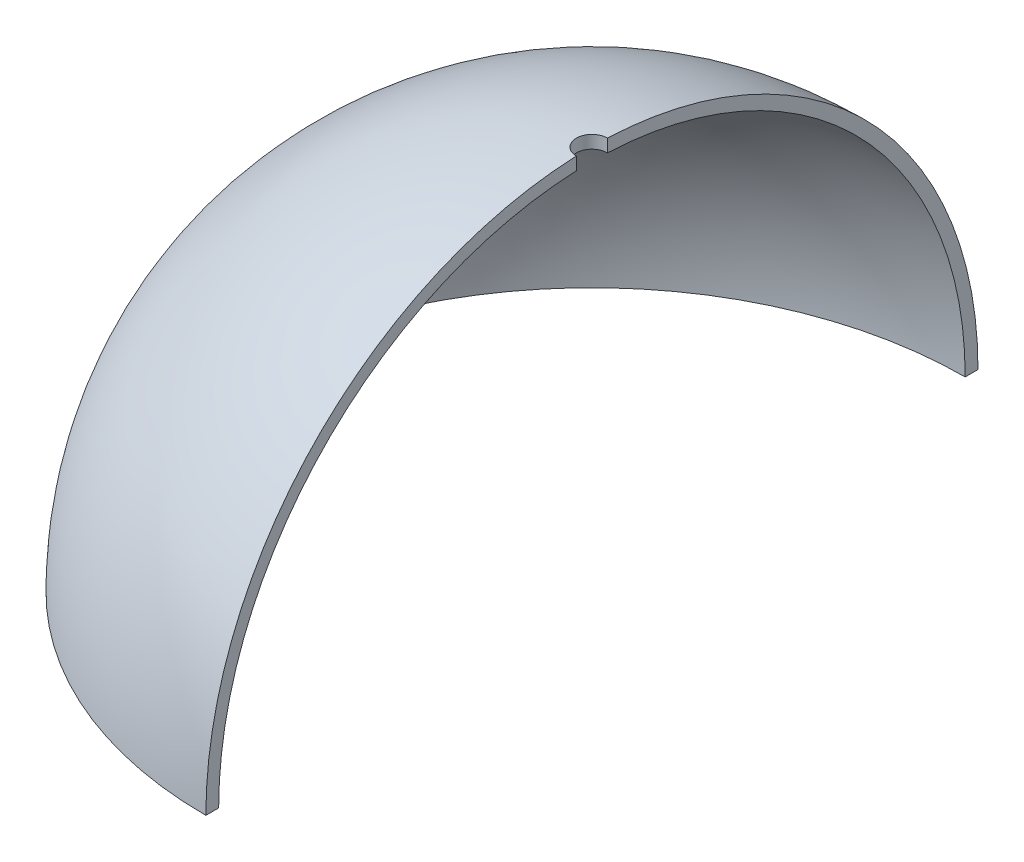
from build123d import *

# Parameters (mm, degrees)
REVOLVE1_ANGLE     = 90
SKETCH5_R          = 400
CUT_EXTRUDE1_DEPTH = 10987


with BuildPart() as part:
    # Sketch2 → Revolve1 (revolve)
    with BuildSketch(Plane(origin=(0, 0, 0), x_dir=(1, 0, 0), z_dir=(0, 1, 0))):
        with BuildLine():
            Line((0, -9945), (0, -9615))
            ThreePointArc((0, -9615), (-9615, 0), (0, 9615))
            Line((0, 9615), (0, 9945))
            ThreePointArc((0, 9945), (-9945, 0), (0, -9945))
        make_face()
    revolve(axis=Axis((0, 0, 3077.152585208), (0, 0, -1)), revolution_arc=REVOLVE1_ANGLE)

    # Sketch5 → Cut-Extrude1 (cut)
    with BuildSketch(Plane(origin=(0, 0, 0), x_dir=(1, 0, 0), z_dir=(0, 1, 0))):
        Circle(SKETCH5_R)
    extrude(amount=CUT_EXTRUDE1_DEPTH, mode=Mode.SUBTRACT)


solid = part.part
